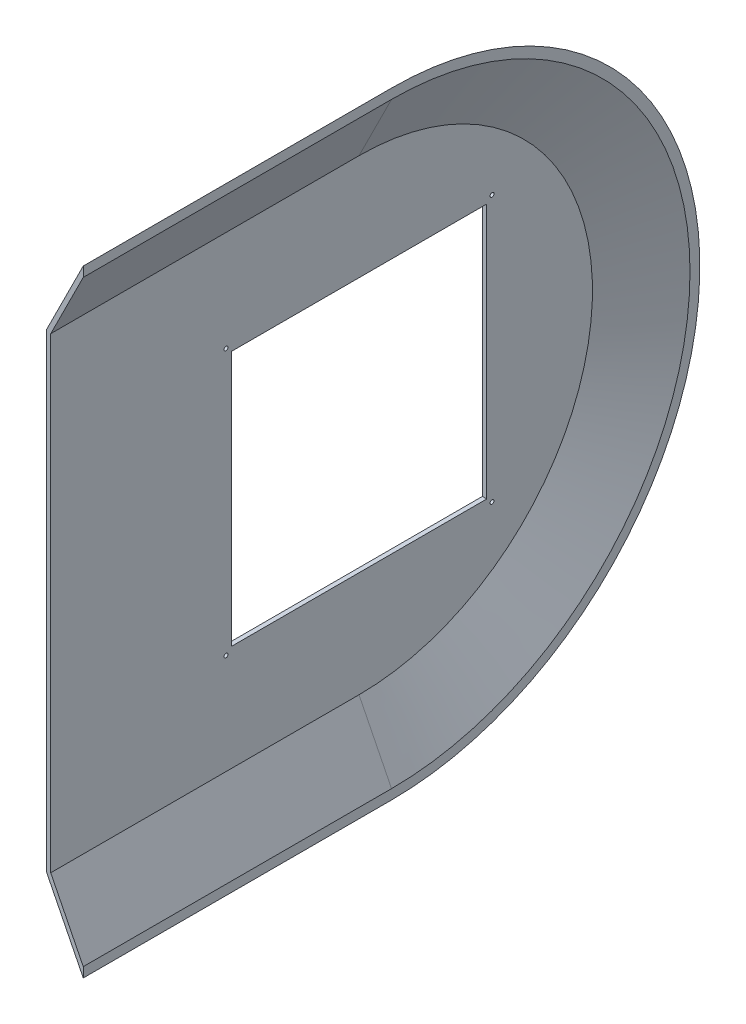
from build123d import *

# Parameters (mm, degrees)
REVOLVE1_ANGLE           = 180
BOSS_EXTRUDE1_DEPTH      = 350
SHELL2_T                 = -5
SKETCH4_W                = 290
SKETCH4_H                = 290
CUT_EXTRUDE1_DEPTH       = 497.747272869
M4_CLEARANCE_HOLE1_D     = 4.5
M4_CLEARANCE_HOLE1_DEPTH = 30
M4_CLEARANCE_HOLE1_TIP   = 1.351936393


with BuildPart() as part:
    # Esquisse2 → Revolve1 (revolve)
    with BuildSketch(Plane.XY):
        Polygon((41.926758797, 350), (41.926758797, 0), (0, 0), (0, 266.190547052), align=None)
    revolve(axis=Axis((41.926758797, 0, 0), (-1, 0, 0)), revolution_arc=REVOLVE1_ANGLE)

    # Sketch5 → Boss-Extrude1 (add)
    with BuildSketch(Plane.XY):
        Polygon((0, 266.190547052), (41.926758797, 350), (41.926758797, -350), (0, -266.190547052), align=None)
    extrude(amount=BOSS_EXTRUDE1_DEPTH)

    # Shell2
    shell2_openings = [part.faces().sort_by_distance(p)[0] for p in [
        (41.926758797, 0, 32.672450622),
        (21.913804754, 0, 350),
    ]]
    offset(amount=SHELL2_T, openings=shell2_openings, kind=Kind.INTERSECTION)

    # Sketch4 → Cut-Extrude1 (cut, through all)
    with BuildSketch(Plane.ZY):
        Rectangle(SKETCH4_W, SKETCH4_H)
    extrude(amount=-CUT_EXTRUDE1_DEPTH, mode=Mode.SUBTRACT)

    # M4 Clearance Hole1
    with Locations(Plane.ZY):
        with Locations((151, 151), (151, -151), (-151, -151), (-151, 151)):
            Hole(M4_CLEARANCE_HOLE1_D / 2, depth=M4_CLEARANCE_HOLE1_DEPTH)
            with Locations((0, 0, -(M4_CLEARANCE_HOLE1_DEPTH + M4_CLEARANCE_HOLE1_TIP / 2))):  # 118° drill point
                Cone(0, M4_CLEARANCE_HOLE1_D / 2, M4_CLEARANCE_HOLE1_TIP, mode=Mode.SUBTRACT)


solid = part.part
